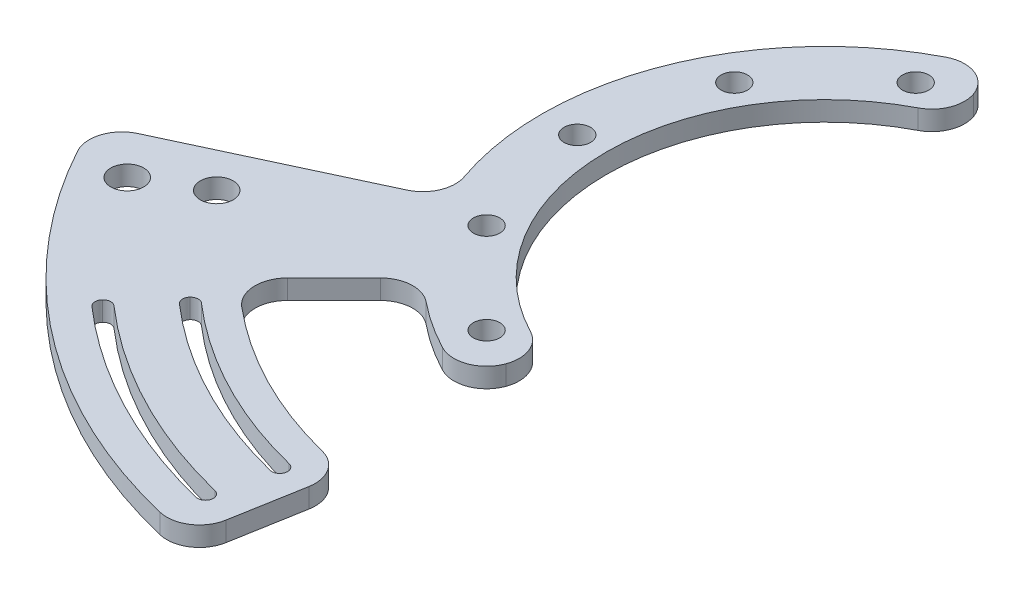
from build123d import *

# Parameters (mm, degrees)
SKETCH1_R               = 43.5
SKETCH1_R_2             = 33.5
BOSS_EXTRUDE1_DEPTH     = 3
SKETCH3_R               = 2.025
CUT_EXTRUDE2_DEPTH      = 62.591395503
CIRPATTERN1_COUNT       = 12
CUT_EXTRUDE1_DEPTH      = 62.591395503
BOSS_EXTRUDE2_DEPTH     = 3
CUT_EXTRUDE_THIN1_DEPTH = 3
FILLET1_R               = 1.2
FILLET2_R               = 5
CUT_EXTRUDE3_DEPTH      = 112.227677485
CUT_EXTRUDE3_DEPTH_BACK = 112.227677485
SKETCH6_R               = 2.525


with BuildPart() as part:
    # Sketch1 → Boss-Extrude1 (new body)
    with BuildSketch(Plane(origin=(0, 0, 0), x_dir=(1, 0, 0), z_dir=(0, 1, 0))):
        with Locations(Location((0, 0, 0), (0, 0, 270))):
            Circle(SKETCH1_R)
        with Locations(Location((0, 0, 0), (0, 0, 270))):
            Circle(SKETCH1_R_2, mode=Mode.SUBTRACT)
    extrude(amount=BOSS_EXTRUDE1_DEPTH)

    # Sketch3 → Cut-Extrude2 (cut, symmetric)
    with BuildSketch(Plane(origin=(0, 3, 0), x_dir=(1, 0, 0), z_dir=(0, 1, 0))):
        with Locations(Location((-38, 0, 0), (0, 0, 270))):
            Circle(SKETCH3_R)
    cut_extrude2 = extrude(amount=CUT_EXTRUDE2_DEPTH, both=True, mode=Mode.SUBTRACT)

    # CirPattern1: Cut-Extrude2 ×12 about axis
    cirpattern1_axis = Axis((0, 0, 0), (0, 1, 0))
    for i in range(1, CIRPATTERN1_COUNT):
        add(cut_extrude2.rotate(cirpattern1_axis, i * 360 / CIRPATTERN1_COUNT), mode=Mode.SUBTRACT)

    # Sketch2 → Cut-Extrude1 (cut, symmetric)
    with BuildSketch(Plane(origin=(0, 3, 0), x_dir=(1, 0, 0), z_dir=(0, 1, 0))):
        with BuildLine():
            Line((0, 0), (43.5, 0))
            ThreePointArc((43.5, 0), (24.950574981, -35.633113927), (-14.877876235, -40.876629004))
            Line((-14.877876235, -40.876629004), (0, 0))
        make_face()
    cut_extrude1 = extrude(amount=CUT_EXTRUDE1_DEPTH, both=True, mode=Mode.SUBTRACT)

    # Mirror1: Cut-Extrude1 across plane
    add(cut_extrude1.mirror(Plane.XY), mode=Mode.SUBTRACT)

    # Sketch4 → Boss-Extrude2 (add)
    with BuildSketch(Plane(origin=(0, 0, 0), x_dir=(1, 0, 0), z_dir=(0, 1, 0))):
        with BuildLine():
            ThreePointArc((-30.759144982, -30.759144982), (-35.633113927, -24.950574981), (-39.424388736, -18.383894386))
            Line((-39.424388736, -18.383894386), (-57.550544477, -26.836259621))
            Line((-57.550544477, -26.836259621), (-76.583008005, -35.711243117))
            ThreePointArc((-76.583008005, -35.711243117), (-51.440340751, -67.038357255), (-14.673271013, -83.21625513))
            Line((-14.673271013, -83.21625513), (-11.026659282, -62.535292316))
            ThreePointArc((-11.026659282, -62.535292316), (-29.32103694, -56.325187907), (-44.901280605, -44.901280605))
            Line((-44.901280605, -44.901280605), (-30.759144982, -30.759144982))
        make_face()
    extrude(amount=BOSS_EXTRUDE2_DEPTH)

    # Sketch5 → Cut-Extrude-Thin1 (cut)
    with BuildSketch(Plane(origin=(0, 3, 0), x_dir=(1, 0, 0), z_dir=(0, 1, 0))):
        with BuildLine():
            ThreePointArc((-46.972968566, -52.168766749), (-32.414752649, -62.268160489), (-15.791564015, -68.400778548))
            Line((-15.791564015, -68.400778548), (-15.251681485, -66.062290392))
            ThreePointArc((-15.251681485, -66.062290392), (-31.306555977, -60.139334489), (-45.367055111, -50.385219167))
            Line((-45.367055111, -50.385219167), (-46.972968566, -52.168766749))
        make_face()
        with BuildLine():
            ThreePointArc((-53.329709327, -59.228642591), (-36.801364475, -70.694763404), (-17.928599031, -77.657294163))
            Line((-17.928599031, -77.657294163), (-17.388716501, -75.318806008))
            ThreePointArc((-17.388716501, -75.318806008), (-35.693167803, -68.565937405), (-51.723795872, -57.445095009))
            Line((-51.723795872, -57.445095009), (-53.329709327, -59.228642591))
        make_face()
    extrude(amount=-CUT_EXTRUDE_THIN1_DEPTH, mode=Mode.SUBTRACT)

    # Fillet1
    fillet1_edges = [part.edges().sort_by_distance(p)[0] for p in [
        (-46.972968566, 1.5, 52.168766749),
        (-53.329709327, 1.5, 59.228642591),
        (-45.367055111, 1.5, 50.385219167),
        (-51.723795872, 1.5, 57.445095009),
        (-15.251681485, 1.5, 66.062290392),
        (-17.388716501, 1.5, 75.318806008),
        (-15.791564015, 1.5, 68.400778548),
        (-17.928599031, 1.5, 77.657294163),
    ]]
    fillet(fillet1_edges, radius=FILLET1_R - 0.0001)  # a hair under: the kernel refuses the full size

    # Fillet2
    fillet2_edges = [part.edges().sort_by_distance(p)[0] for p in [
        (-14.877876235, 1.5, -40.876629004),
        (-11.457674801, 1.5, -31.479702796),
        (-11.457674801, 1.5, 31.479702796),
        (-14.877876235, 1.5, 40.876629004),
        (-39.424388736, 1.5, 18.383894386),
        (-76.583008005, 1.5, 35.711243117),
        (-14.673271013, 1.5, 83.21625513),
        (-11.026659282, 1.5, 62.535292316),
        (-30.759144982, 1.5, 30.759144982),
        (-44.901280605, 1.5, 44.901280605),
    ]]
    fillet(fillet2_edges, radius=FILLET2_R - 0.0001)  # a hair under: the kernel refuses the full size

    # Sketch6 → Cut-Extrude3 (cut, two sides: drawn at the far end of the back side and taken through both)
    with BuildSketch(Plane(origin=(0, 3, 0), x_dir=(1, 0, 0), z_dir=(0, 1, 0)).offset(-CUT_EXTRUDE3_DEPTH_BACK)):
        with Locations(Location((-58.287376448, -35.022589094, 0), (0, 0, 270))):
            Circle(SKETCH6_R)
        with Locations(Location((-66.859049455, -40.172969843, 0), (0, 0, 270))):
            Circle(SKETCH6_R)
    extrude(amount=CUT_EXTRUDE3_DEPTH + CUT_EXTRUDE3_DEPTH_BACK, mode=Mode.SUBTRACT)


solid = part.part
